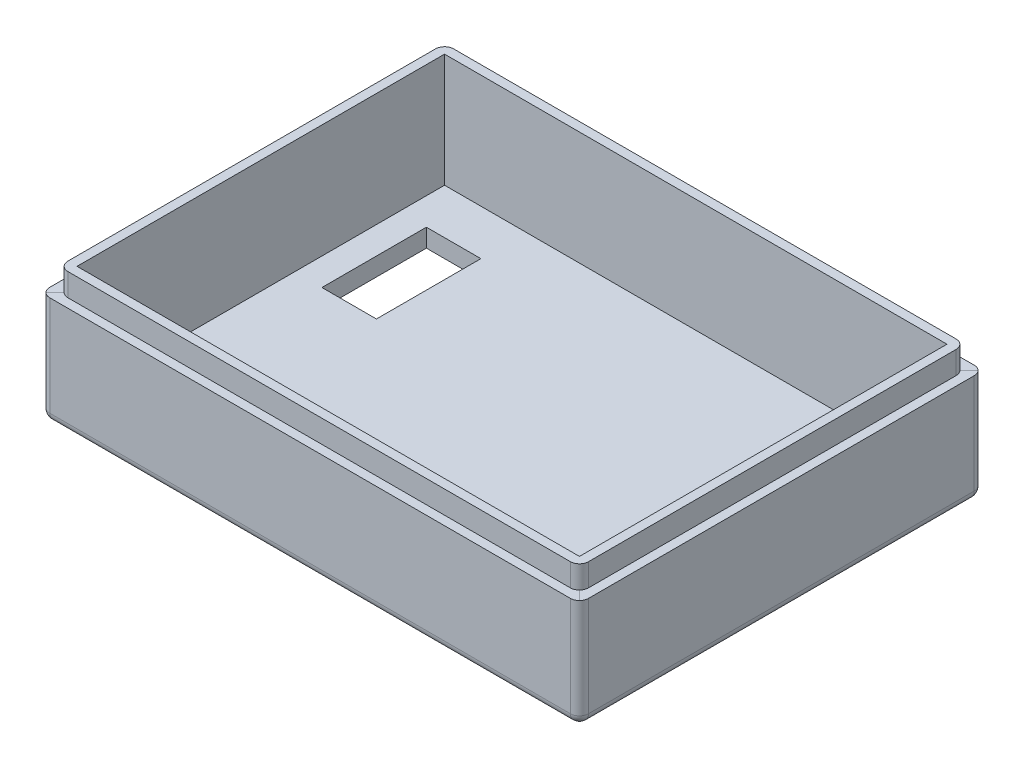
from build123d import *

# Parameters (mm, degrees)
SKETCH1_W           = 59.31
SKETCH1_H           = 44.46
BOSS_EXTRUDE1_DEPTH = 2
SKETCH2_W           = 59.31
SKETCH2_H           = 44.46
SKETCH2_W_2         = 55.31
SKETCH2_H_2         = 40.46
BOSS_EXTRUDE2_DEPTH = 12.5
SKETCH3_W           = 1
SKETCH3_H           = 2.5
FILLET1_R           = 1
SKETCH5_W           = 6
SKETCH5_H           = 11.5
CUT_EXTRUDE1_DEPTH  = 10
BOSS_EXTRUDE3_DEPTH = 2


with BuildPart() as part:
    # Sketch1 → Boss-Extrude1 (new body)
    with BuildSketch(Plane(origin=(0, 0, 0), x_dir=(1, 0, 0), z_dir=(0, 1, 0))):
        Rectangle(SKETCH1_W, SKETCH1_H)
    extrude(amount=BOSS_EXTRUDE1_DEPTH)

    # Sketch2 → Boss-Extrude2 (add)
    with BuildSketch(Plane(origin=(0, 2, 0), x_dir=(1, 0, 0), z_dir=(0, 1, 0))):
        Rectangle(SKETCH2_W, SKETCH2_H)
        Rectangle(SKETCH2_W_2, SKETCH2_H_2, mode=Mode.SUBTRACT)
    extrude(amount=BOSS_EXTRUDE2_DEPTH)

    # Cut-Sweep1: sweep along a path in Sketch4
    with BuildLine(Plane(origin=(0, 14.5, 0), x_dir=(1, 0, 0), z_dir=(0, 1, 0))) as cut_sweep1_path:
        Line((-29.655, -22.23), (29.655, -22.23))
        Line((29.655, -22.23), (29.655, 22.23))
        Line((29.655, 22.23), (-29.655, 22.23))
        Line((-29.655, 22.23), (-29.655, -22.23))
    # Sketch3 → Cut-Sweep1 (sweep, cut)
    with BuildSketch(Plane(origin=(29.655, 0, 0), x_dir=(0, 0, -1), z_dir=(1, 0, 0))):
        with Locations((-21.73, 13.25)):
            Rectangle(SKETCH3_W, SKETCH3_H)
    sweep(path=cut_sweep1_path.line, transition=Transition.RIGHT, mode=Mode.SUBTRACT)

    # Fillet1
    fillet1_edges = [part.edges().sort_by_distance(p)[0] for p in [
        (29.655, 6, 22.23),
        (-29.655, 6, 22.23),
        (-29.655, 6, -22.23),
        (29.655, 6, -22.23),
        (-28.655, 13.25, -21.23),
        (28.655, 13.25, -21.23),
        (28.655, 13.25, 21.23),
        (-28.655, 13.25, 21.23),
        (29.655, 0, 0),
        (0, 0, -22.23),
        (-29.655, 0, 0),
        (0, 0, 22.23),
    ]]
    fillet(fillet1_edges, radius=FILLET1_R)

    # Sketch5 → Cut-Extrude1 (cut)
    with BuildSketch(Plane(origin=(0, 0, 0), x_dir=(-1, 0, 0), z_dir=(0, -1, 0))):
        with Locations((21.655, 9.48)):
            Rectangle(SKETCH5_W, SKETCH5_H)
    extrude(amount=-CUT_EXTRUDE1_DEPTH, mode=Mode.SUBTRACT)

    # Sketch6 → Boss-Extrude3 (add)
    with BuildSketch(Plane.XZ):
        with BuildLine():
            Line((3.668359532, 11.043003806), (5.069466615, 11.043003806))
            Line((5.069466615, 11.043003806), (13.724692633, -5.981200546))
            add(Edge.make_bspline(
                [(13.724692633, -5.981200546), (13.770465415, -6.066255609), (13.860276332, -6.233142412), (14.049596398, -6.44471403), (14.259282132, -6.635498751), (14.514562764, -6.779774023), (14.797989941, -6.899882103), (15.118123905, -6.972877212), (15.467702486, -7.031048399), (15.713066528, -7.034166281), (15.841418927, -7.035797276)],
                knots=[0, 0, 0, 0, 0.923122777, 1.811262043, 2.707284477, 3.630407254, 4.607627564, 5.650245945, 6.770820012, 8, 8, 8, 8], degree=3))
            Line((15.841418927, -7.035797276), (16.587169471, -7.035797276))
            Line((16.587169471, -7.035797276), (16.587169471, -8))
            Line((16.587169471, -8), (6.704091546, -8))
            Line((6.704091546, -8), (6.704091546, -7.035797276))
            Line((6.704091546, -7.035797276), (7.491272677, -7.035797276))
            add(Edge.make_bspline(
                [(7.491272677, -7.035797276), (7.615561715, -7.034972065), (7.854152468, -7.033387954), (8.197254943, -7.024270941), (8.510837169, -6.998643255), (8.797935797, -6.976226749), (9.056099226, -6.935998597), (9.287242582, -6.897915489), (9.488634661, -6.845109649), (9.610791127, -6.800614432), (9.66826164, -6.779680927)],
                knots=[0, 0, 0, 0, 1.354335262, 2.59984206, 3.738199698, 4.78223889, 5.735982514, 6.583888141, 7.33376694, 8, 8, 8, 8], degree=3))
            add(Edge.make_bspline(
                [(9.66826164, -6.779680927), (9.734616654, -6.749406693), (9.857910933, -6.693154125), (9.99935023, -6.559441952), (10.092017823, -6.401790611), (10.10075551, -6.2849798), (10.105166, -6.226017644)],
                knots=[0, 0, 0, 0, 1.157571245, 2.15088362, 3.06662844, 4, 4, 4, 4], degree=3))
            add(Edge.make_bspline(
                [(10.105166, -6.226017644), (10.098921578, -6.149754311), (10.08575846, -5.988992716), (10.021947105, -5.840695302), (9.988407076, -5.762748366)],
                knots=[0, 0, 0, 0, 0.948775522, 2, 2, 2, 2], degree=3))
            Line((9.988407076, -5.762748366), (7.939476287, -1.732682292))
            Line((7.939476287, -1.732682292), (-1.495398027, -1.732682292))
            Line((-1.495398027, -1.732682292), (-2.666753681, -4.045262263))
            add(Edge.make_bspline(
                [(-2.666753681, -4.045262263), (-2.73463111, -4.18986222), (-2.860946743, -4.458953658), (-2.99975414, -4.849828516), (-3.097335174, -5.191789881), (-3.109447861, -5.40819885), (-3.114957291, -5.506632017)],
                knots=[0, 0, 0, 0, 1.244034282, 2.315069679, 3.233612959, 4, 4, 4, 4], degree=3))
            add(Edge.make_bspline(
                [(-3.114957291, -5.506632017), (-3.105178856, -5.610008506), (-3.085538794, -5.817640973), (-2.930679332, -6.11109022), (-2.683549261, -6.372065908), (-2.348052402, -6.608977598), (-1.921244388, -6.804306269), (-1.406472367, -6.937233956), (-0.80918362, -7.025851211), (-0.382171294, -7.032338986), (-0.154553614, -7.035797276)],
                knots=[0, 0, 0, 0, 0.676796425, 1.359350793, 2.130179084, 3.02304161, 4.041766613, 5.196580708, 6.505645488, 8, 8, 8, 8], degree=3))
            Line((-0.154553614, -7.035797276), (0.677824519, -7.035797276))
            Line((0.677824519, -7.035797276), (0.677824519, -8))
            Line((0.677824519, -8), (-8.241050681, -8))
            Line((-8.241050681, -8), (-8.241050681, -7.035797276))
            add(Edge.make_bspline(
                [(-8.241050681, -7.035797276), (-8.00595871, -7.030682959), (-7.560198321, -7.020985648), (-6.930404722, -6.931476506), (-6.376944833, -6.783238723), (-5.886269273, -6.568068877), (-5.442332689, -6.26093688), (-5.039212162, -5.844454164), (-4.645254972, -5.330344026), (-4.423041234, -4.933672593), (-4.305145029, -4.723217304)],
                knots=[0, 0, 0, 0, 1.157126977, 2.194040787, 3.123941644, 3.970721164, 4.81957436, 5.763811563, 6.813583119, 8, 8, 8, 8], degree=3))
            Line((-4.305145029, -4.723217304), (3.668359532, 11.043003806))
        make_face()
        Polygon((3.208856671, 7.570367432), (-1.009530248, -0.768479567), (7.446075674, -0.768479567), align=None, mode=Mode.SUBTRACT)
    extrude(amount=BOSS_EXTRUDE3_DEPTH)


solid = part.part
